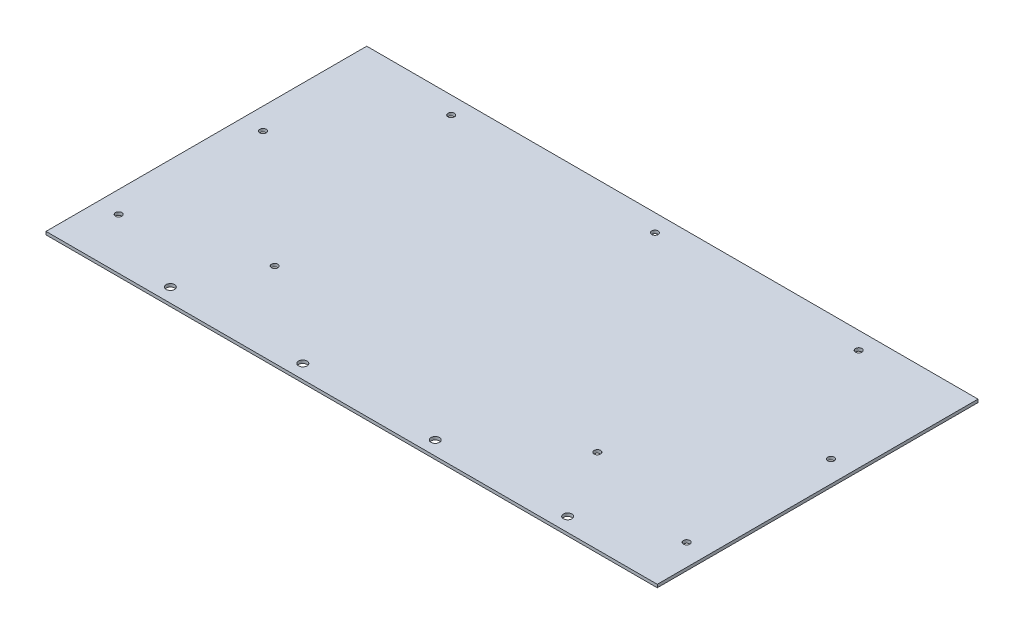
from build123d import *

# Parameters (mm, degrees)
SKETCH1_W            = 457.223
SKETCH1_H            = 2.286
BOSS_EXTRUDE1_DEPTH  = 238.315200026
SKETCH9_R            = 3.175
CUT_EXTRUDE10_DEPTH  = 2.54
LPATTERN1_COUNT      = 4
LPATTERN1_PITCH      = 99.06
SKETCH15_W           = 457.223
SKETCH15_H           = 2.286
BOSS_EXTRUDE3_DEPTH  = 1.5875
M4_CLEARANCE_HOLE1_D = 4.8


with BuildPart() as part:
    # Sketch1 → Boss-Extrude1 (new body)
    with BuildSketch(Plane.XY):
        Rectangle(SKETCH1_W, SKETCH1_H)
    extrude(amount=BOSS_EXTRUDE1_DEPTH)

    # Sketch9 → Cut-Extrude10 (cut)
    with BuildSketch(Plane(origin=(0, 1.143, 0), x_dir=(1, 0, 0), z_dir=(0, 1, 0))):
        with Locations((-146.0615, -229.425200026)):
            Circle(SKETCH9_R)
    cut_extrude10 = extrude(amount=-CUT_EXTRUDE10_DEPTH, mode=Mode.SUBTRACT)

    # LPattern1: Cut-Extrude10 ×4
    with Locations(*[(i * LPATTERN1_PITCH, 0, 0) for i in range(1, LPATTERN1_COUNT)]):
        add(cut_extrude10, mode=Mode.SUBTRACT)

    # Sketch15 → Boss-Extrude3 (add)
    with BuildSketch(Plane.XY.offset(238.315200026)):
        Rectangle(SKETCH15_W, SKETCH15_H)
    extrude(amount=BOSS_EXTRUDE3_DEPTH)

    # M4 Clearance Hole1 (through all)
    with Locations(Plane.XZ.offset(1.143)):
        with Locations((-212.419, 201.724823778), (-212.419, 93.774823778), (-152.4, 13.0175), (0, 13.0175), (152.4, 13.0175), (212.419, 93.774823778), (212.419, 201.724823778), (120.65, 176.776), (-120.65, 176.776)):
            Hole(M4_CLEARANCE_HOLE1_D / 2)


solid = part.part
